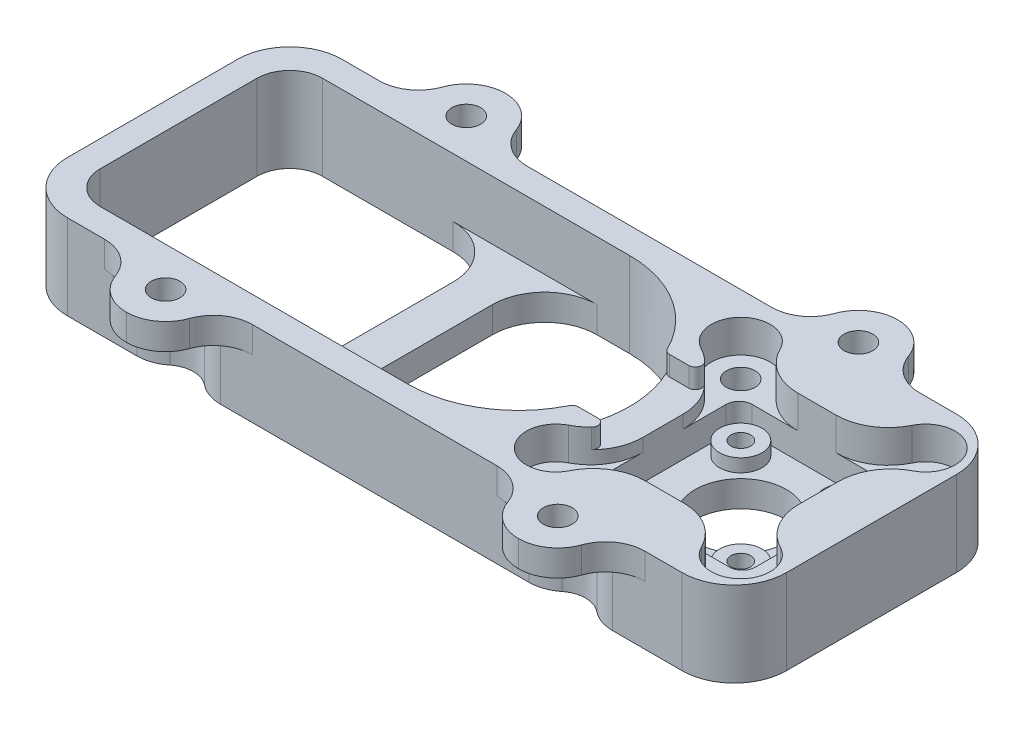
from build123d import *

# Parameters (mm, degrees)
ESQUISSE1_W              = 120
ESQUISSE1_H              = 42
ESQUISSE1_R              = 2.2
ESQUISSE1_R_2            = 1.5
BOSS_EXTRU_1_DEPTH       = 8
ESQUISSE2_W              = 23.8
ESQUISSE2_H              = 23.3
ENL_V_MAT_EXTRU_1_DEPTH  = 2
CONG_1_R                 = 2
ENL_V_START              = -2
ESQUISSE4_R              = 3.25
ENL_V_MAT_EXTRU_2_DEPTH  = 2
ESQUISSE5_R              = 7
ENL_V_MAT_EXTRU_3_DEPTH  = 93.504053965
ENL_V_MAT_EXTRU_4_DEPTH  = 93.763139231
ESQUISSE8_W              = 6
ESQUISSE8_H              = 34
BOSS_EXTRU_2_DEPTH       = 8
CONG_2_R                 = 8
ESQUISSE9_W              = 10
ESQUISSE9_H              = 42
ENL_V_MAT_EXTRU_5_DEPTH  = 93.763139231
CONG_3_R                 = 8
BOSS_EXTRU_3_DEPTH       = 5
CONG_4_R                 = 8
ENL_V_START_2            = -9
ENL_V_MAT_EXTRU_6_DEPTH  = 9
ESQUISSE13_W             = 23.395732087
ESQUISSE13_H             = 34
ENL_V_MAT_EXTRU_7_DEPTH  = 94.327380763
CONG_5_R                 = 5
ESQUISSE14_W             = 12
ESQUISSE14_H             = 4
BOSS_EXTRU_4_DEPTH       = 8
ESQUISSE15_W             = 12
ESQUISSE15_H             = 4
BOSS_EXTRU_5_DEPTH       = 8
CONG_6_R                 = 6
ESQUISSE16_R             = 2.2
ENL_V_MAT_EXTRU_8_DEPTH  = 96.446319992
ESQUISSE17_R             = 4.25
ENL_V_MAT_EXTRU_9_DEPTH  = 9
CONG_7_R                 = 6
CONG_8_R                 = 6
ESQUISSE19_W             = 17.468807988
ESQUISSE19_H             = 13.923856562
ENL_V_MAT_EXTRU_10_DEPTH = 3
CONG_9_R                 = 1


# Some blends are built 0.0001 mm under size
with BuildPart() as part:
    # Esquisse1 → Boss.-Extru.1 (new body)
    with BuildSketch(Plane(origin=(0, 0, 0), x_dir=(1, 0, 0), z_dir=(0, 1, 0))):
        with Locations((-30, 0)):
            Rectangle(ESQUISSE1_W, ESQUISSE1_H)
        with Locations(Location((14.142135624, 14.142135624, 0), (0, 0, 270))):
            Circle(ESQUISSE1_R, mode=Mode.SUBTRACT)
        with Locations(Location((14.142135624, -14.142135624, 0), (0, 0, 270))):
            Circle(ESQUISSE1_R, mode=Mode.SUBTRACT)
        with Locations(Location((-14.142135624, -14.142135624, 0), (0, 0, 270))):
            Circle(ESQUISSE1_R, mode=Mode.SUBTRACT)
        with Locations(Location((-14.142135624, 14.142135624, 0), (0, 0, 270))):
            Circle(ESQUISSE1_R, mode=Mode.SUBTRACT)
        with Locations(Location((-8, 8, 0), (0, 0, 270))):
            Circle(ESQUISSE1_R_2, mode=Mode.SUBTRACT)
        with Locations(Location((-8, -8, 0), (0, 0, 270))):
            Circle(ESQUISSE1_R_2, mode=Mode.SUBTRACT)
        with Locations(Location((8, -8, 0), (0, 0, 270))):
            Circle(ESQUISSE1_R_2, mode=Mode.SUBTRACT)
        with Locations(Location((8, 8, 0), (0, 0, 270))):
            Circle(ESQUISSE1_R_2, mode=Mode.SUBTRACT)
    extrude(amount=BOSS_EXTRU_1_DEPTH)

    # Esquisse2 → Enlèv. mat.-Extru.1 (cut)
    with BuildSketch(Plane(origin=(0, 8, 0), x_dir=(1, 0, 0), z_dir=(0, 1, 0))):
        Rectangle(ESQUISSE2_W, ESQUISSE2_H)
    extrude(amount=-ENL_V_MAT_EXTRU_1_DEPTH, mode=Mode.SUBTRACT)

    # Congé1
    cong_1_edges = [part.edges().sort_by_distance(p)[0] for p in [
        (-11.9, 7, 11.65),
        (-11.9, 7, -11.65),
        (11.9, 7, -11.65),
        (11.9, 7, 11.65),
    ]]
    fillet(cong_1_edges, radius=CONG_1_R)

    # Esquisse4 → Enlèv. mat.-Extru.2 (cut)
    with BuildSketch(Plane(origin=(0, 6, 0), x_dir=(1, 0, 0), z_dir=(0, 1, 0)).offset(ENL_V_START)):
        with BuildLine():
            Line((-11.9, 9.65), (-11.9, -9.65))
            ThreePointArc((-11.9, -9.65), (-11.314213562, -11.064213562), (-9.9, -11.65))
            Line((-9.9, -11.65), (9.9, -11.65))
            ThreePointArc((9.9, -11.65), (11.314213562, -11.064213562), (11.9, -9.65))
            Line((11.9, -9.65), (11.9, 9.65))
            ThreePointArc((11.9, 9.65), (11.314213562, 11.064213562), (9.9, 11.65))
            Line((9.9, 11.65), (-9.9, 11.65))
            ThreePointArc((-9.9, 11.65), (-11.314213562, 11.064213562), (-11.9, 9.65))
        make_face()
        with Locations(Location((8, 8, 0), (0, 0, 270))):
            Circle(ESQUISSE4_R, mode=Mode.SUBTRACT)
        with Locations(Location((-8, 8, 0), (0, 0, 270))):
            Circle(ESQUISSE4_R, mode=Mode.SUBTRACT)
        with Locations(Location((-8, -8, 0), (0, 0, 270))):
            Circle(ESQUISSE4_R, mode=Mode.SUBTRACT)
        with Locations(Location((8, -8, 0), (0, 0, 270))):
            Circle(ESQUISSE4_R, mode=Mode.SUBTRACT)
    extrude(amount=ENL_V_MAT_EXTRU_2_DEPTH, mode=Mode.SUBTRACT)

    # Esquisse5 → Enlèv. mat.-Extru.3 (cut, through all)
    with BuildSketch(Plane(origin=(0, 4, 0), x_dir=(1, 0, 0), z_dir=(0, 1, 0))):
        with Locations(Location((0, 0, 0), (0, 0, 270))):
            Circle(ESQUISSE5_R)
    extrude(amount=-ENL_V_MAT_EXTRU_3_DEPTH, mode=Mode.SUBTRACT)

    # Esquisse6 → Enlèv. mat.-Extru.4 (cut, through all)
    with BuildSketch(Plane(origin=(0, 8, 0), x_dir=(1, 0, 0), z_dir=(0, 1, 0))):
        with BuildLine():
            Line((-68, 17), (-34, 17))
            ThreePointArc((-34, 17), (-17, 0), (-34, -17))
            Line((-34, -17), (-68, -17))
            ThreePointArc((-68, -17), (-85, 0), (-68, 17))
        make_face()
    extrude(amount=-ENL_V_MAT_EXTRU_4_DEPTH, mode=Mode.SUBTRACT)

    # Esquisse8 → Boss.-Extru.2 (add)
    with BuildSketch(Plane(origin=(0, 8, 0), x_dir=(1, 0, 0), z_dir=(0, 1, 0))):
        with Locations((-50, 0)):
            Rectangle(ESQUISSE8_W, ESQUISSE8_H)
    extrude(amount=-BOSS_EXTRU_2_DEPTH)

    # Congé2
    cong_2_edges = [part.edges().sort_by_distance(p)[0] for p in [
        (-53, 4, 17),
        (-53, 4, -17),
        (-47, 4, -17),
        (-47, 4, 17),
    ]]
    fillet(cong_2_edges, radius=CONG_2_R)

    # Esquisse9 → Enlèv. mat.-Extru.5 (cut, through all)
    with BuildSketch(Plane(origin=(0, 8, 0), x_dir=(1, 0, 0), z_dir=(0, 1, 0))):
        with Locations((25, 0)):
            Rectangle(ESQUISSE9_W, ESQUISSE9_H)
    extrude(amount=-ENL_V_MAT_EXTRU_5_DEPTH, mode=Mode.SUBTRACT)

    # Congé3
    cong_3_edges = [part.edges().sort_by_distance(p)[0] for p in [
        (20, 4, 21),
        (20, 4, -21),
        (-90, 4, -21),
        (-90, 4, 21),
    ]]
    fillet(cong_3_edges, radius=CONG_3_R)

    # Esquisse10 → Boss.-Extru.3 (add)
    with BuildSketch(Plane(origin=(0, 8, 0), x_dir=(1, 0, 0), z_dir=(0, 1, 0))):
        with BuildLine():
            Line((12, 21), (-82, 21))
            ThreePointArc((-82, 21), (-87.656854249, 18.656854249), (-90, 13))
            Line((-90, 13), (-90, -13))
            ThreePointArc((-90, -13), (-87.656854249, -18.656854249), (-82, -21))
            Line((-82, -21), (12, -21))
            ThreePointArc((12, -21), (17.656854249, -18.656854249), (20, -13))
            Line((20, -13), (20, 13))
            ThreePointArc((20, 13), (17.656854249, 18.656854249), (12, 21))
        make_face()
        with BuildLine():
            Line((-39, -17), (-34, -17))
            ThreePointArc((-34, -17), (-17, 0), (-34, 17))
            Line((-34, 17), (-39, 17))
            ThreePointArc((-39, 17), (-44.656854249, 14.656854249), (-47, 9))
            Line((-47, 9), (-47, -9))
            ThreePointArc((-47, -9), (-44.656854249, -14.656854249), (-39, -17))
        make_face(mode=Mode.SUBTRACT)
        with BuildLine():
            Line((-61, 17), (-68, 17))
            ThreePointArc((-68, 17), (-85, 0), (-68, -17))
            Line((-68, -17), (-61, -17))
            ThreePointArc((-61, -17), (-55.343145751, -14.656854249), (-53, -9))
            Line((-53, -9), (-53, 9))
            ThreePointArc((-53, 9), (-55.343145751, 14.656854249), (-61, 17))
        make_face(mode=Mode.SUBTRACT)
        with BuildLine():
            Line((-11.9, 9.65), (-11.9, -9.65))
            ThreePointArc((-11.9, -9.65), (-11.872122849, -9.982763383), (-11.789268531, -10.30625027))
            ThreePointArc((-11.789268531, -10.30625027), (-17.231773328, -17.413853652), (-10.447111779, -11.573712219))
            ThreePointArc((-10.447111779, -11.573712219), (-10.176202428, -11.630836242), (-9.9, -11.65))
            Line((-9.9, -11.65), (9.9, -11.65))
            ThreePointArc((9.9, -11.65), (10.176202428, -11.630836242), (10.447111779, -11.573712219))
            ThreePointArc((10.447111779, -11.573712219), (17.231773328, -17.413853652), (11.789268531, -10.30625027))
            ThreePointArc((11.789268531, -10.30625027), (11.872122849, -9.982763383), (11.9, -9.65))
            Line((11.9, -9.65), (11.9, 9.65))
            ThreePointArc((11.9, 9.65), (11.872122849, 9.982763383), (11.789268531, 10.30625027))
            ThreePointArc((11.789268531, 10.30625027), (17.231773328, 17.413853652), (10.447111779, 11.573712219))
            ThreePointArc((10.447111779, 11.573712219), (10.176202428, 11.630836242), (9.9, 11.65))
            Line((9.9, 11.65), (-9.9, 11.65))
            ThreePointArc((-9.9, 11.65), (-10.176202428, 11.630836242), (-10.447111779, 11.573712219))
            ThreePointArc((-10.447111779, 11.573712219), (-17.231773328, 17.413853652), (-11.789268531, 10.30625027))
            ThreePointArc((-11.789268531, 10.30625027), (-11.872122849, 9.982763383), (-11.9, 9.65))
        make_face(mode=Mode.SUBTRACT)
    extrude(amount=BOSS_EXTRU_3_DEPTH)

    # Congé4
    # the kernel refuses this fillet: 8 mm, written as the material it takes off along each edge
    with BuildSketch(Plane(origin=(-11.789268531, 8, 10.30625027), x_dir=(-0.9993610722438664, 0, -0.035741394538964716), z_dir=(0, 1, 0))) as cong_4_piece_1:
        with BuildLine():
            CenterArc((8.364996913, -6.964496446), CONG_4_R, 119.475980174, 62.572287137)
            Line((0.370108335, -7.250427602), (-0.429380523, -7.279020718))
            ThreePointArc((-0.429380523, -7.279020718), (-0.665372839, -0.680466392), (-0.74584245, -0.289342426))
            Line((-0.74584245, -0.289342426), (0.393646914, 0.696449645))
            ThreePointArc((0.393646914, 0.696449645), (2.214263889, 0.217529251), (4.034880864, 0.696449645))
            Line((4.034880864, 0.696449645), (4.428527777, 0))
        make_face()
    extrude(amount=23.149669521, mode=Mode.SUBTRACT)
    with BuildSketch(Plane(origin=(-10.447111779, 8, 11.573712219), x_dir=(0.07549442305242757, 0, 0.9971462240253337), z_dir=(0, 1, 0))) as cong_4_piece_2:
        with BuildLine():
            CenterArc((8.621417802, 6.894899054), CONG_4_R, 175.670368799, 63.855969723)
            Line((0.64424801, 7.498854438), (-0.153468969, 7.559249976))
            ThreePointArc((-0.153468969, 7.559249976), (-0.680343018, 0.600186681), (-0.750767395, 0.276311995))
            Line((-0.750767395, 0.276311995), (0.405713779, -0.689489905))
            ThreePointArc((0.405713779, -0.689489905), (2.282140006, -0.178380718), (4.158566234, -0.689489905))
            Line((4.158566234, -0.689489905), (4.564280013, 0))
        make_face()
    extrude(amount=23.816195381, mode=Mode.SUBTRACT)
    with BuildSketch(Plane(origin=(10.447111779, 8, 11.573712219), x_dir=(-0.07549442305230755, 0, 0.9971462240253428), z_dir=(0, 1, 0)), Plane(origin=(-10.447111779, 8, -11.573712219), x_dir=(0.07549442305210272, 0, -0.9971462240253584), z_dir=(0, 1, 0))) as cong_4_piece_3:
        with BuildLine():
            CenterArc((8.621417802, -6.894899054), CONG_4_R, 120.473661478, 63.855969723)
            Line((0.64424801, -7.498854438), (-0.153468969, -7.559249976))
            ThreePointArc((-0.153468969, -7.559249976), (-0.680343018, -0.600186681), (-0.750767395, -0.276311995))
            Line((-0.750767395, -0.276311995), (0.405713779, 0.689489905))
            ThreePointArc((0.405713779, 0.689489905), (2.282140006, 0.178380718), (4.158566234, 0.689489905))
            Line((4.158566234, 0.689489905), (4.564280013, 0))
        make_face()
    extrude(amount=23.816195381, mode=Mode.SUBTRACT)
    with BuildSketch(Plane(origin=(11.789268531, 8, 10.30625027), x_dir=(0.9993610722438551, 0, -0.03574139453927694), z_dir=(0, 1, 0)), Plane(origin=(-11.789268531, 8, -10.30625027), x_dir=(-0.9993610722438627, 0, 0.03574139453906518), z_dir=(0, 1, 0))) as cong_4_piece_4:
        with BuildLine():
            CenterArc((8.364996913, 6.964496446), CONG_4_R, 177.951732689, 62.572287137)
            Line((0.370108335, 7.250427602), (-0.429380523, 7.279020718))
            ThreePointArc((-0.429380523, 7.279020718), (-0.665372839, 0.680466392), (-0.74584245, 0.289342426))
            Line((-0.74584245, 0.289342426), (0.393646914, -0.696449645))
            ThreePointArc((0.393646914, -0.696449645), (2.214263889, -0.217529251), (4.034880864, -0.696449645))
            Line((4.034880864, -0.696449645), (4.428527777, 0))
        make_face()
    extrude(amount=23.149669521, mode=Mode.SUBTRACT)
    with BuildSketch(Plane(origin=(11.789268531, 8, -10.30625027), x_dir=(0.01525254616124988, 0, 0.9998836731518317), z_dir=(0, 1, 0))) as cong_4_piece_5:
        with BuildLine():
            CenterArc((7.381888178, 7.999069385), CONG_4_R, 206.553772453, 62.572287137)
            Line((0.225766513, 4.422769241), (-0.489845653, 4.065139226))
            ThreePointArc((-0.489845653, 4.065139226), (-0.104363135, 2.22247427), (-0.675475897, 0.428640073))
            Line((-0.675475897, 0.428640073), (0.25094311, -0.759623298))
            ThreePointArc((0.25094311, -0.759623298), (0.645660831, -0.699197838), (7.247665771, -0.799906939))
            Line((7.247665771, -0.799906939), (7.259867808, 0))
        make_face()
    extrude(amount=23.149669521, mode=Mode.SUBTRACT)
    with BuildSketch(Plane(origin=(10.447111779, 8, -11.573712219), x_dir=(-0.9999486302426401, 0, -0.01013592007997942), z_dir=(0, 1, 0))) as cong_4_piece_6:
        with BuildLine():
            CenterArc((7.607565513, -7.999589042), CONG_4_R, 90.580755387, 63.855969723)
            Line((0.390691138, -4.547528171), (-0.330996299, -4.202322084))
            ThreePointArc((-0.330996299, -4.202322084), (0.017619545, -2.289033036), (-0.652231235, -0.463243366))
            Line((-0.652231235, -0.463243366), (0.211034032, 0.771663552))
            ThreePointArc((0.211034032, 0.771663552), (0.539748185, 0.729220523), (7.518369416, 0.799958904))
            Line((7.518369416, 0.799958904), (7.526478153, 0))
        make_face()
    extrude(amount=23.816195381, mode=Mode.SUBTRACT)

    # Esquisse11 → Enlèv. mat.-Extru.6 (cut)
    with BuildSketch(Plane(origin=(0, 13, 0), x_dir=(1, 0, 0), z_dir=(0, 1, 0)).offset(ENL_V_START_2)):
        with BuildLine():
            Line((-68, 17), (-34, 17))
            ThreePointArc((-34, 17), (-17, 0), (-34, -17))
            Line((-34, -17), (-68, -17))
            ThreePointArc((-68, -17), (-85, 0), (-68, 17))
        make_face()
    extrude(amount=ENL_V_MAT_EXTRU_6_DEPTH, mode=Mode.SUBTRACT)

    # Esquisse13 → Enlèv. mat.-Extru.7 (cut, through all)
    with BuildSketch(Plane(origin=(0, 13, 0), x_dir=(1, 0, 0), z_dir=(0, 1, 0))):
        with Locations((-74.302133957, 0)):
            Rectangle(ESQUISSE13_W, ESQUISSE13_H)
    extrude(amount=-ENL_V_MAT_EXTRU_7_DEPTH, mode=Mode.SUBTRACT)

    # Congé5
    cong_5_edges = [part.edges().sort_by_distance(p)[0] for p in [
        (-86, 6.5, -17),
        (-86, 6.5, 17),
    ]]
    fillet(cong_5_edges, radius=CONG_5_R)

    # Esquisse14 → Boss.-Extru.4 (add)
    with BuildSketch(Plane(origin=(0, 0, -21), x_dir=(-1, 0, 0), z_dir=(0, 0, -1))):
        with Locations((65, 11)):
            Rectangle(ESQUISSE14_W, ESQUISSE14_H)
        with Locations((5, 11)):
            Rectangle(ESQUISSE14_W, ESQUISSE14_H)
    extrude(amount=BOSS_EXTRU_4_DEPTH)

    # Esquisse15 → Boss.-Extru.5 (add)
    with BuildSketch(Plane.XY.offset(21)):
        with Locations((-5, 11)):
            Rectangle(ESQUISSE15_W, ESQUISSE15_H)
        with Locations((-65, 11)):
            Rectangle(ESQUISSE15_W, ESQUISSE15_H)
    extrude(amount=BOSS_EXTRU_5_DEPTH)

    # Congé6
    cong_6_edges = [part.edges().sort_by_distance(p)[0] for p in [
        (-71, 11, -29),
        (-59, 11, -29),
        (-11, 11, -29),
        (1, 11, -29),
        (1, 11, 29),
        (-11, 11, 29),
        (-59, 11, 29),
        (-71, 11, 29),
    ]]
    fillet(cong_6_edges, radius=CONG_6_R - 0.0001)  # a hair under: the kernel refuses the full size

    # Esquisse16 → Enlèv. mat.-Extru.8 (cut, through all)
    with BuildSketch(Plane(origin=(0, 13, 0), x_dir=(1, 0, 0), z_dir=(0, 1, 0))):
        with Locations(Location((-65, 23, 0), (0, 0, 270))):
            Circle(ESQUISSE16_R)
        with Locations(Location((-5, -23, 0), (0, 0, 270))):
            Circle(ESQUISSE16_R)
        with Locations(Location((-5, 23, 0), (0, 0, 245.380022671))):
            Circle(ESQUISSE16_R)
        with Locations(Location((-65, -23, 0), (0, 0, 114.619977329))):
            Circle(ESQUISSE16_R)
    extrude(amount=-ENL_V_MAT_EXTRU_8_DEPTH, mode=Mode.SUBTRACT)

    # Esquisse17 → Enlèv. mat.-Extru.9 (cut)
    with BuildSketch(Plane(origin=(0, 0, 0), x_dir=(1, 0, 0), z_dir=(0, 1, 0))):
        with Locations((-65, 23)):
            Circle(ESQUISSE17_R)
        with Locations((-5, 23)):
            Circle(ESQUISSE17_R)
        with Locations((-65, -23)):
            Circle(ESQUISSE17_R)
        with Locations((-5, -23)):
            Circle(ESQUISSE17_R)
    extrude(amount=ENL_V_MAT_EXTRU_9_DEPTH, mode=Mode.SUBTRACT)

    # Congé7
    cong_7_edges = [part.edges().sort_by_distance(p)[0] for p in [
        (-68.75, 4.5, 21),
        (-61.25, 4.5, 21),
        (-8.75, 4.5, 21),
        (-1.25, 4.5, 21),
        (-8.75, 4.5, -21),
        (-1.25, 4.5, -21),
        (-61.25, 4.5, -21),
        (-68.75, 4.5, -21),
    ]]
    fillet(cong_7_edges, radius=CONG_7_R)

    # Congé8
    # the kernel refuses this fillet: 6 mm, written as the material it adds along each edge
    with BuildSketch(Plane(origin=(-11, 9, 20.986111735), x_dir=(0.08517389906412692, 0, 0.996366100847582), z_dir=(0, 1, 0)), Plane(origin=(1, 9, -20.986111735), x_dir=(-0.08517389906412681, 0, -0.996366100847582), z_dir=(0, 1, 0))) as cong_8_piece_1:
        with BuildLine():
            CenterArc((5.539442635, -5.806654513), CONG_8_R, 104.584858197, 70.529116987)
            Line((-0.43875397, -5.295611118), (-1.03657363, -5.244506779))
            ThreePointArc((-1.03657363, -5.244506779), (-0.618733054, -0.356598746), (-0.599911, 0.010334031))
            Line((-0.599911, 0.010334031), (0.051104339, 0.597819661))
            ThreePointArc((0.051104339, 0.597819661), (2.057773974, 0.426280427), (3.877472817, 0.580665451))
            Line((3.877472817, 0.580665451), (4.028560983, 0))
        make_face()
    extrude(amount=4)
    with BuildSketch(Plane(origin=(1, 9, 20.986111735), x_dir=(0.9999965844275012, 0, 0.0026136436887378585), z_dir=(0, 1, 0)), Plane(origin=(-59, 9, 20.986111735), x_dir=(0.9999965844275012, 0, 0.0026136436887378585), z_dir=(0, 1, 0))) as cong_8_piece_2:
        with BuildLine():
            CenterArc((5.3294378, -5.999979507), CONG_8_R, 90.149750923, 70.529116987)
            Line((-0.332636114, -4.014804703), (-0.898843505, -3.816287223))
            ThreePointArc((-0.898843505, -3.816287223), (-0.594734103, -2.015549572), (-0.599997951, -0.001568186))
            Line((-0.599997951, -0.001568186), (0.039235585, 0.598715766))
            ThreePointArc((0.039235585, 0.598715766), (0.406469528, 0.587176107), (5.312187751, 0.599997951))
            Line((5.312187751, 0.599997951), (5.313755938, 0))
        make_face()
    extrude(amount=4)
    with BuildSketch(Plane(origin=(-71, 9, 20.986111735), x_dir=(-0.9999965844275012, 0, 0.0026136436887378585), z_dir=(0, 1, 0)), Plane(origin=(-59, 9, -20.986111735), x_dir=(0.9999965844275012, 0, -0.0026136436887378585), z_dir=(0, 1, 0))) as cong_8_piece_3:
        with BuildLine():
            CenterArc((5.3294378, 5.999979507), CONG_8_R, 199.32113209, 70.529116987)
            Line((-0.332636114, 4.014804703), (-0.898843505, 3.816287223))
            ThreePointArc((-0.898843505, 3.816287223), (-0.594734103, 2.015549572), (-0.599997951, 0.001568186))
            Line((-0.599997951, 0.001568186), (0.039235585, -0.598715766))
            ThreePointArc((0.039235585, -0.598715766), (0.406469528, -0.587176107), (5.312187751, -0.599997951))
            Line((5.312187751, -0.599997951), (5.313755938, 0))
        make_face()
    extrude(amount=4)
    with BuildSketch(Plane(origin=(-71, 9, -20.986111735), x_dir=(0.0851738990641256, 0, -0.996366100847582), z_dir=(0, 1, 0)), Plane(origin=(-11, 9, -20.986111735), x_dir=(0.08517389906412692, 0, -0.996366100847582), z_dir=(0, 1, 0))) as cong_8_piece_4:
        with BuildLine():
            CenterArc((5.539442635, 5.806654513), CONG_8_R, 184.886024817, 70.529116987)
            Line((-0.43875397, 5.295611118), (-1.03657363, 5.244506779))
            ThreePointArc((-1.03657363, 5.244506779), (-0.618733054, 0.356598746), (-0.599911, -0.010334031))
            Line((-0.599911, -0.010334031), (0.051104339, -0.597819661))
            ThreePointArc((0.051104339, -0.597819661), (2.057773974, -0.426280427), (3.877472817, -0.580665451))
            Line((3.877472817, -0.580665451), (4.028560983, 0))
        make_face()
    extrude(amount=4)

    # Esquisse19 → Enlèv. mat.-Extru.10 (cut)
    with BuildSketch(Plane(origin=(0, 13, 0), x_dir=(1, 0, 0), z_dir=(0, 1, 0))):
        with Locations((-14.701449298, 0)):
            Rectangle(ESQUISSE19_W, ESQUISSE19_H)
    extrude(amount=-ENL_V_MAT_EXTRU_10_DEPTH, mode=Mode.SUBTRACT)

    # Congé9
    cong_9_edges = [part.edges().sort_by_distance(p)[0] for p in [
        (-12.923244757, 11.5, -6.961928281),
        (-12.923244757, 11.5, 6.961928281),
        (-18.490920253, 11.5, 6.961928281),
        (-18.490920253, 11.5, -6.961928281),
    ]]
    fillet(cong_9_edges, radius=CONG_9_R)


solid = part.part
